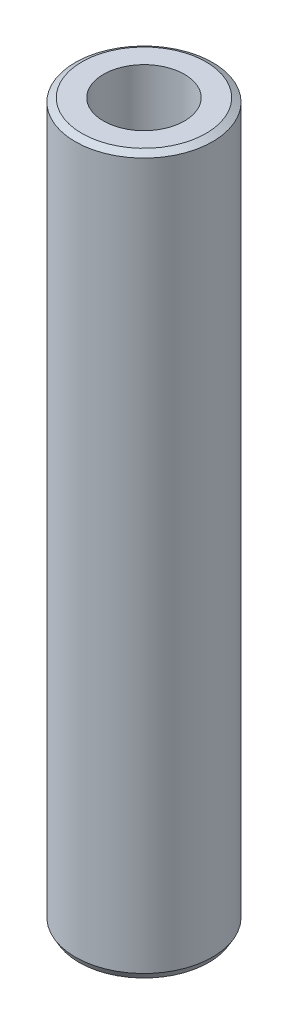
from build123d import *
from OCP.BRepFilletAPI import BRepFilletAPI_MakeChamfer

# Parameters (mm, degrees)
SKETCH1_R           = 57.5
BOSS_EXTRUDE1_DEPTH = 600
SKETCH2_R           = 33.909232465
CUT_EXTRUDE1_DEPTH  = 606.485342515
CHAMFER1_SIZE       = 3.2000901
CHAMFER1_SIZE2      = 5.542718642


with BuildPart() as part:
    # Sketch1 → Boss-Extrude1 (new body)
    with BuildSketch(Plane(origin=(0, 0, 0), x_dir=(1, 0, 0), z_dir=(0, 1, 0))):
        Circle(SKETCH1_R)
    extrude(amount=BOSS_EXTRUDE1_DEPTH)

    # Sketch2 → Cut-Extrude1 (cut, through all)
    with BuildSketch(Plane(origin=(0, 0, 0), x_dir=(1, 0, 0), z_dir=(0, 1, 0))):
        Circle(SKETCH2_R)
    extrude(amount=CUT_EXTRUDE1_DEPTH, mode=Mode.SUBTRACT)

    # Chamfer1: one chamfer whose edges measure the first distance from different faces: ONE call of the kernel's chamfer builder (chamfer() names one face for all edges)
    chamfer1_edges_1 = [part.edges().sort_by_distance(p)[0] for p in [
        (-57.5, 600, 0),
    ]]
    chamfer1_side_1 = [part.faces().sort_by_distance(p)[0] for p in [
        (-57.5, 300, 0),
    ]]
    chamfer1_edges_2 = [part.edges().sort_by_distance(p)[0] for p in [
        (-57.5, 0, 0),
    ]]
    chamfer1_side_2 = [part.faces().sort_by_distance(p)[0] for p in [
        (-55.873654403, 0, 0),
    ]]
    chamfer1 = BRepFilletAPI_MakeChamfer(part.part.solid().wrapped)
    for e in chamfer1_edges_1:
        chamfer1.Add(CHAMFER1_SIZE, CHAMFER1_SIZE2, e.wrapped, chamfer1_side_1[0].wrapped)  # the first distance lies on this face
    for e in chamfer1_edges_2:
        chamfer1.Add(CHAMFER1_SIZE, CHAMFER1_SIZE2, e.wrapped, chamfer1_side_2[0].wrapped)  # the first distance lies on this face
    add(Compound.cast(chamfer1.Shape()), mode=Mode.REPLACE)


solid = part.part
